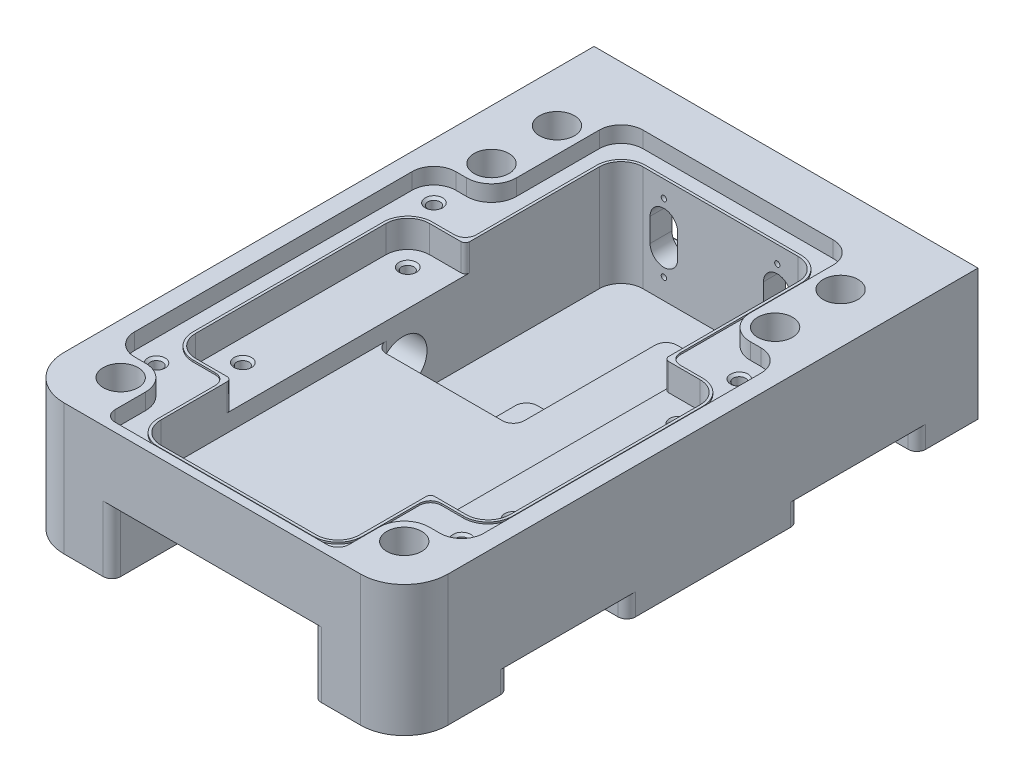
from build123d import *
from build123d.topology import SkipClean

# Parameters (mm, degrees)
SKETCH2_R                       = 2.54
BOSS_EXTRUDE1_DEPTH             = 9.525
CUT_EXTRUDE1_DEPTH              = 6.35
CUT_EXTRUDE7_DEPTH              = 2.3495
CUT_EXTRUDE8_DEPTH              = 12.7
F_0_80_TAPPED_HOLE2_D           = 1.19126
F_0_80_TAPPED_HOLE2_DEPTH       = 3.048
F_0_80_TAPPED_HOLE2_CSINK_D     = 1.905
F_0_80_TAPPED_HOLE2_CSINK_ANGLE = 90
F_0_80_TAPPED_HOLE2_TIP         = 0.357890611
BOSS_EXTRUDE2_START             = 4.0005
BOSS_EXTRUDE2_DEPTH             = 4.0005
F_0_80_TAPPED_HOLE1_D           = 1.19126
F_0_80_TAPPED_HOLE1_DEPTH       = 7.62
F_0_80_TAPPED_HOLE1_CSINK_D     = 1.905
F_0_80_TAPPED_HOLE1_CSINK_ANGLE = 90
F_0_80_TAPPED_HOLE1_TIP         = 0.357890611
BOSS_EXTRUDE9_START             = 0.254
BOSS_EXTRUDE9_DEPTH             = 0.254
LID_AND_GASKET_RECESS_DEPTH     = 2.3495
CUT_EXTRUDE19_DEPTH             = 15.113
BOSS_EXTRUDE7_START             = 11.43
BOSS_EXTRUDE7_DEPTH             = 11.43
F_2_56_TAPPED_HOLE1_AT_2_COUNT  = 2
F_2_56_TAPPED_HOLE1_AT_2_PITCH  = 24.003
CUT_EXTRUDE23_DEPTH             = 2.3495
CUT_EXTRUDE45_DEPTH             = 3.683
F_2_56_TAPPED_HOLE2_D           = 1.778
F_2_56_TAPPED_HOLE2_DEPTH       = 7.62
F_2_56_TAPPED_HOLE2_CSINK_D     = 2.54
F_2_56_TAPPED_HOLE2_CSINK_ANGLE = 100
F_2_56_TAPPED_HOLE2_TIP         = 0.53416509
BOSS_EXTRUDE14_START            = 8.89
BOSS_EXTRUDE14_DEPTH            = 8.89
CUT_EXTRUDE43_DEPTH             = 2.54
BOSS_EXTRUDE15_START            = 0.254
BOSS_EXTRUDE15_DEPTH            = 0.254
CUT_EXTRUDE54_DEPTH             = 9.525
CUT_EXTRUDE41_REACH             = 56.849
SKETCH133_R                     = 2.1082
CUT_EXTRUDE41_DIRECTION_2_DEPTH = 55.848857864
CUT_EXTRUDE47_DEPTH             = 76.067770602
CUT_EXTRUDE47_DEPTH_BACK        = 4.445
M8X0_75_TAPPED_HOLE1_D          = 7
M8X0_75_TAPPED_HOLE1_DEPTH      = 19.05
M8X0_75_TAPPED_HOLE1_TIP        = 2.103012167
CUT_EXTRUDE52_DEPTH             = 3.175
CUT_EXTRUDE53_DEPTH             = 2.54
FILLET4_R                       = 1.27
CUT_EXTRUDE55_START             = -4.445
CUT_EXTRUDE55_DEPTH             = 4.445
FILLET5_R                       = 1.27
CUT_EXTRUDE56_DEPTH             = 55.848857882
CUT_EXTRUDE56_DEPTH_BACK        = 18.0975
SKETCH155_R                     = 4.365625
CUT_EXTRUDE57_DEPTH             = 3.81


with BuildPart() as part:
    # Sketch2 → Boss-Extrude1 (new, symmetric)
    # profile 1 of 8: a face of its own
    with SkipClean():  # the faces are left unmerged after this step: merging them gives an invalid solid
        with BuildSketch(Plane(origin=(0, 0, 0), x_dir=(1, 0, 0), z_dir=(0, 1, 0))):
            with BuildLine():
                ThreePointArc((-27.94, 42.8625), (-26.080128061, 47.352628061), (-21.59, 49.2125))
                Line((-21.59, 49.2125), (-27.94, 49.2125))
                Line((-27.94, 49.2125), (-27.94, 42.8625))
            make_face()
        # profile 2 of 8: a face of its own
        with BuildSketch(Plane(origin=(0, 0, 0), x_dir=(1, 0, 0), z_dir=(0, 1, 0))):
            with BuildLine():
                Line((21.59, 49.2125), (-21.59, 49.2125))
                ThreePointArc((-21.59, 49.2125), (-26.080128061, 47.352628061), (-27.94, 42.8625))
                ThreePointArc((-27.94, 42.8625), (-27.690261841, 34.53040929), (-26.941944002, 26.22823336))
                ThreePointArc((-26.941944002, 26.22823336), (-21.017816046, 33.326100769), (-14.2875, 26.9875))
                ThreePointArc((-14.2875, 26.9875), (-16.971325791, 21.802746711), (-22.754166667, 21.000662586))
                ThreePointArc((-22.754166667, 21.000662586), (-21.220123356, 19.840330984), (-20.6375, 18.007243879))
                Line((-20.6375, 18.007243879), (-20.6375, -18.007243879))
                ThreePointArc((-20.6375, -18.007243879), (-21.220123356, -19.840330984), (-22.754166667, -21.000662586))
                ThreePointArc((-22.754166667, -21.000662586), (-16.971325791, -21.802746711), (-14.2875, -26.9875))
                ThreePointArc((-14.2875, -26.9875), (-16.147371939, -31.477628061), (-20.6375, -33.3375))
                Line((-20.6375, -33.3375), (20.6375, -33.3375))
                ThreePointArc((20.6375, -33.3375), (14.378949146, -25.913702435), (22.754166667, -21.000662586))
                ThreePointArc((22.754166667, -21.000662586), (21.220123356, -19.840330984), (20.6375, -18.007243879))
                Line((20.6375, -18.007243879), (20.6375, 18.007243879))
                ThreePointArc((20.6375, 18.007243879), (21.220123356, 19.840330984), (22.754166667, 21.000662586))
                ThreePointArc((22.754166667, 21.000662586), (15.452746711, 30.653674209), (26.9875, 26.9875))
                ThreePointArc((26.9875, 26.9875), (26.976100769, 26.607183954), (26.941944002, 26.22823336))
                ThreePointArc((26.941944002, 26.22823336), (27.690261841, 34.53040929), (27.94, 42.8625))
                ThreePointArc((27.94, 42.8625), (26.080128061, 47.352628061), (21.59, 49.2125))
            make_face()
            with Locations(Location((-20.6375, 36.5125, 0), (0, 0, 90))):
                Circle(SKETCH2_R, mode=Mode.SUBTRACT)
            with Locations(Location((20.6375, 36.5125, 0), (0, 0, 90))):
                Circle(SKETCH2_R, mode=Mode.SUBTRACT)
        # profile 3 of 8: a face of its own
        with BuildSketch(Plane(origin=(0, 0, 0), x_dir=(1, 0, 0), z_dir=(0, 1, 0))):
            with BuildLine():
                Line((27.94, 49.2125), (21.59, 49.2125))
                ThreePointArc((21.59, 49.2125), (26.080128061, 47.352628061), (27.94, 42.8625))
                Line((27.94, 42.8625), (27.94, 49.2125))
            make_face()
        # profile 4 of 8: a face of its own
        with BuildSketch(Plane(origin=(0, 0, 0), x_dir=(1, 0, 0), z_dir=(0, 1, 0))):
            with BuildLine():
                ThreePointArc((-26.941944002, 26.22823336), (-27.690261841, 34.53040929), (-27.94, 42.8625))
                Line((-27.94, 42.8625), (-27.94, -27.94))
                ThreePointArc((-27.94, -27.94), (-26.080128061, -32.430128061), (-21.59, -34.29))
                Line((-21.59, -34.29), (21.59, -34.29))
                ThreePointArc((21.59, -34.29), (26.080128061, -32.430128061), (27.94, -27.94))
                Line((27.94, -27.94), (27.94, 42.8625))
                ThreePointArc((27.94, 42.8625), (27.690261841, 34.53040929), (26.941944002, 26.22823336))
                ThreePointArc((26.941944002, 26.22823336), (25.593370284, 23.017380389), (22.754166667, 21.000662586))
                ThreePointArc((22.754166667, 21.000662586), (21.220123356, 19.840330984), (20.6375, 18.007243879))
                Line((20.6375, 18.007243879), (20.6375, -18.007243879))
                ThreePointArc((20.6375, -18.007243879), (21.220123356, -19.840330984), (22.754166667, -21.000662586))
                ThreePointArc((22.754166667, -21.000662586), (25.822253289, -23.321325791), (26.9875, -26.9875))
                ThreePointArc((26.9875, -26.9875), (25.127628061, -31.477628061), (20.6375, -33.3375))
                Line((20.6375, -33.3375), (-20.6375, -33.3375))
                ThreePointArc((-20.6375, -33.3375), (-26.896050854, -28.061297565), (-22.754166667, -21.000662586))
                ThreePointArc((-22.754166667, -21.000662586), (-21.220123356, -19.840330984), (-20.6375, -18.007243879))
                Line((-20.6375, -18.007243879), (-20.6375, 18.007243879))
                ThreePointArc((-20.6375, 18.007243879), (-21.220123356, 19.840330984), (-22.754166667, 21.000662586))
                ThreePointArc((-22.754166667, 21.000662586), (-25.593370284, 23.017380389), (-26.941944002, 26.22823336))
            make_face()
        # profile 5 of 8: a face of its own
        with BuildSketch(Plane(origin=(0, 0, 0), x_dir=(1, 0, 0), z_dir=(0, 1, 0))):
            with BuildLine():
                ThreePointArc((-14.2875, 26.9875), (-21.017816046, 33.326100769), (-26.941944002, 26.22823336))
                ThreePointArc((-26.941944002, 26.22823336), (-25.593370284, 23.017380389), (-22.754166667, 21.000662586))
                ThreePointArc((-22.754166667, 21.000662586), (-16.971325791, 21.802746711), (-14.2875, 26.9875))
            make_face()
            with Locations(Location((-20.6375, 26.9875, 0), (0, 0, 90))):
                Circle(SKETCH2_R, mode=Mode.SUBTRACT)
        # profile 6 of 8: a face of its own
        with BuildSketch(Plane(origin=(0, 0, 0), x_dir=(1, 0, 0), z_dir=(0, 1, 0))):
            with BuildLine():
                ThreePointArc((22.754166667, 21.000662586), (25.593370284, 23.017380389), (26.941944002, 26.22823336))
                ThreePointArc((26.941944002, 26.22823336), (26.976100769, 26.607183954), (26.9875, 26.9875))
                ThreePointArc((26.9875, 26.9875), (15.452746711, 30.653674209), (22.754166667, 21.000662586))
            make_face()
            with Locations(Location((20.6375, 26.9875, 0), (0, 0, 90))):
                Circle(SKETCH2_R, mode=Mode.SUBTRACT)
        # profile 7 of 8: a face of its own
        with BuildSketch(Plane(origin=(0, 0, 0), x_dir=(1, 0, 0), z_dir=(0, 1, 0))):
            with BuildLine():
                ThreePointArc((-14.2875, -26.9875), (-16.971325791, -21.802746711), (-22.754166667, -21.000662586))
                ThreePointArc((-22.754166667, -21.000662586), (-26.896050854, -28.061297565), (-20.6375, -33.3375))
                ThreePointArc((-20.6375, -33.3375), (-16.147371939, -31.477628061), (-14.2875, -26.9875))
            make_face()
            with Locations(Location((-20.6375, -26.9875, 0), (0, 0, 90))):
                Circle(SKETCH2_R, mode=Mode.SUBTRACT)
        # profile 8 of 8: a face of its own
        with BuildSketch(Plane(origin=(0, 0, 0), x_dir=(1, 0, 0), z_dir=(0, 1, 0))):
            with BuildLine():
                ThreePointArc((26.9875, -26.9875), (25.822253289, -23.321325791), (22.754166667, -21.000662586))
                ThreePointArc((22.754166667, -21.000662586), (14.378949146, -25.913702435), (20.6375, -33.3375))
                ThreePointArc((20.6375, -33.3375), (25.127628061, -31.477628061), (26.9875, -26.9875))
            make_face()
            with Locations(Location((20.6375, -26.9875, 0), (0, 0, 90))):
                Circle(SKETCH2_R, mode=Mode.SUBTRACT)
        extrude(amount=BOSS_EXTRUDE1_DEPTH, both=True)

    # Sketch4 → Cut-Extrude1 (cut)
    with BuildSketch(Plane(origin=(0, 0, -49.2125), x_dir=(-1, 0, 0), z_dir=(0, 0, -1))):
        with BuildLine():
            Line((-23.8125, -6.7945), (23.8125, -6.7945))
            ThreePointArc((23.8125, -6.7945), (24.935032015, -6.329532015), (25.4, -5.207))
            Line((25.4, -5.207), (25.4, 5.207))
            ThreePointArc((25.4, 5.207), (24.935032015, 6.329532015), (23.8125, 6.7945))
            Line((23.8125, 6.7945), (-23.8125, 6.7945))
            ThreePointArc((-23.8125, 6.7945), (-24.935032015, 6.329532015), (-25.4, 5.207))
            Line((-25.4, 5.207), (-25.4, -5.207))
            ThreePointArc((-25.4, -5.207), (-24.935032015, -6.329532015), (-23.8125, -6.7945))
        make_face()
    extrude(amount=-CUT_EXTRUDE1_DEPTH, mode=Mode.SUBTRACT)

    # Sketch11 → Cut-Extrude7 (cut)
    with BuildSketch(Plane(origin=(0, 0, -49.2125), x_dir=(-1, 0, 0), z_dir=(0, 0, -1))):
        with BuildLine():
            Line((-27.432, 5.207), (-27.432, -5.207))
            ThreePointArc((-27.432, -5.207), (-26.371872995, -7.766372995), (-23.8125, -8.8265))
            Line((-23.8125, -8.8265), (23.8125, -8.8265))
            ThreePointArc((23.8125, -8.8265), (26.371872995, -7.766372995), (27.432, -5.207))
            Line((27.432, -5.207), (27.432, 5.207))
            ThreePointArc((27.432, 5.207), (26.371872995, 7.766372995), (23.8125, 8.8265))
            Line((23.8125, 8.8265), (-23.8125, 8.8265))
            ThreePointArc((-23.8125, 8.8265), (-26.371872995, 7.766372995), (-27.432, 5.207))
        make_face()
    extrude(amount=-CUT_EXTRUDE7_DEPTH, mode=Mode.SUBTRACT)

    # Sketch13 → Cut-Extrude8 (cut)
    with BuildSketch(Plane(origin=(0, 0, -42.8625), x_dir=(-1, 0, 0), z_dir=(0, 0, -1))):
        with BuildLine():
            Line((6.25, -1.7145), (6.25, 1.7145))
            ThreePointArc((6.25, 1.7145), (8.255, 3.7195), (10.26, 1.7145))
            Line((10.26, 1.7145), (10.26, -1.7145))
            ThreePointArc((10.26, -1.7145), (8.255, -3.7195), (6.25, -1.7145))
        make_face()
        with BuildLine():
            Line((-6.25, -1.7145), (-6.25, 1.7145))
            ThreePointArc((-6.25, 1.7145), (-8.255, 3.7195), (-10.26, 1.7145))
            Line((-10.26, 1.7145), (-10.26, -1.7145))
            ThreePointArc((-10.26, -1.7145), (-8.255, -3.7195), (-6.25, -1.7145))
        make_face()
    extrude(amount=-CUT_EXTRUDE8_DEPTH, mode=Mode.SUBTRACT)

    # #0-80 Tapped Hole2
    with Locations(Plane(origin=(23.8125, 5.207, -42.8625), x_dir=(-1, 0, 0), z_dir=(0, 0, -1))):
        with Locations((0, 0), (0, -10.414), (15.5575, -10.16), (15.5575, -0.254), (32.0675, -0.254), (32.0675, -10.16), (47.625, -10.414), (47.625, 0)):
            CounterSinkHole(F_0_80_TAPPED_HOLE2_D / 2, F_0_80_TAPPED_HOLE2_CSINK_D / 2, depth=F_0_80_TAPPED_HOLE2_DEPTH, counter_sink_angle=F_0_80_TAPPED_HOLE2_CSINK_ANGLE)
            with Locations((0, 0, -(F_0_80_TAPPED_HOLE2_DEPTH + F_0_80_TAPPED_HOLE2_TIP / 2))):  # 118° drill point
                Cone(0, F_0_80_TAPPED_HOLE2_D / 2, F_0_80_TAPPED_HOLE2_TIP, mode=Mode.SUBTRACT)

    # Sketch16 → Boss-Extrude2 (add)
    with BuildSketch(Plane(origin=(0, 0, -42.8625), x_dir=(-1, 0, 0), z_dir=(0, 0, -1)).offset(BOSS_EXTRUDE2_START)):
        with BuildLine():
            Line((-23.014, 2.990522163), (-23.014, -2.990522163))
            ThreePointArc((-23.014, -2.990522163), (-23.216818656, -3.455757895), (-23.695714286, -3.623801545))
            ThreePointArc((-23.695714286, -3.623801545), (-24.892953361, -4.043910672), (-25.4, -5.207))
            Line((-25.4, -5.207), (-25.4, 5.207))
            ThreePointArc((-25.4, 5.207), (-24.892953361, 4.043910672), (-23.695714286, 3.623801545))
            ThreePointArc((-23.695714286, 3.623801545), (-23.216818656, 3.455757895), (-23.014, 2.990522163))
        make_face()
    boss_extrude2 = extrude(amount=-BOSS_EXTRUDE2_DEPTH)

    # Mirror1: Boss-Extrude2 across plane
    add(boss_extrude2.mirror(Plane(origin=(0, 0, 0), x_dir=(0, 0, 1), z_dir=(1, 0, 0))))

    # #0-80 Tapped Hole1
    with Locations(Plane(origin=(25.223, 0, -46.863), x_dir=(-1, 0, 0), z_dir=(0, 0, -1))):
        with Locations((0, 0), (50.446, 0)):
            CounterSinkHole(F_0_80_TAPPED_HOLE1_D / 2, F_0_80_TAPPED_HOLE1_CSINK_D / 2, depth=F_0_80_TAPPED_HOLE1_DEPTH, counter_sink_angle=F_0_80_TAPPED_HOLE1_CSINK_ANGLE)
            with Locations((0, 0, -(F_0_80_TAPPED_HOLE1_DEPTH + F_0_80_TAPPED_HOLE1_TIP / 2))):  # 118° drill point
                Cone(0, F_0_80_TAPPED_HOLE1_D / 2, F_0_80_TAPPED_HOLE1_TIP, mode=Mode.SUBTRACT)

    # Sketch104 → Boss-Extrude9 (add)
    with BuildSketch(Plane(origin=(0, 0, -46.863), x_dir=(-1, 0, 0), z_dir=(0, 0, -1)).offset(BOSS_EXTRUDE9_START)):
        with BuildLine():
            ThreePointArc((24.080632184, 3.256846831), (25.776407936, 5.341379569), (23.8125, 7.1755))
            Line((23.8125, 7.1755), (-23.8125, 7.1755))
            ThreePointArc((-23.8125, 7.1755), (-25.776407936, 5.341379569), (-24.080632184, 3.256846831))
            ThreePointArc((-24.080632184, 3.256846831), (-23.590478498, 2.992136648), (-23.395, 2.470494747))
            Line((-23.395, 2.470494747), (-23.395, -2.470494747))
            ThreePointArc((-23.395, -2.470494747), (-23.590478498, -2.992136648), (-24.080632184, -3.256846831))
            ThreePointArc((-24.080632184, -3.256846831), (-25.776407936, -5.341379569), (-23.8125, -7.1755))
            Line((-23.8125, -7.1755), (23.8125, -7.1755))
            ThreePointArc((23.8125, -7.1755), (25.776407936, -5.341379569), (24.080632184, -3.256846831))
            ThreePointArc((24.080632184, -3.256846831), (23.590478498, -2.992136648), (23.395, -2.470494747))
            Line((23.395, -2.470494747), (23.395, 2.470494747))
            ThreePointArc((23.395, 2.470494747), (23.590478498, 2.992136648), (24.080632184, 3.256846831))
        make_face()
        with BuildLine():
            Line((23.014, 2.990522163), (23.014, -2.990522163))
            ThreePointArc((23.014, -2.990522163), (23.216818656, -3.455757895), (23.695714286, -3.623801545))
            ThreePointArc((23.695714286, -3.623801545), (25.398924249, -5.148567547), (23.8125, -6.7945))
            Line((23.8125, -6.7945), (-23.8125, -6.7945))
            ThreePointArc((-23.8125, -6.7945), (-25.398924249, -5.148567547), (-23.695714286, -3.623801545))
            ThreePointArc((-23.695714286, -3.623801545), (-23.216818656, -3.455757895), (-23.014, -2.990522163))
            Line((-23.014, -2.990522163), (-23.014, 2.990522163))
            ThreePointArc((-23.014, 2.990522163), (-23.216818656, 3.455757895), (-23.695714286, 3.623801545))
            ThreePointArc((-23.695714286, 3.623801545), (-25.398924249, 5.148567547), (-23.8125, 6.7945))
            Line((-23.8125, 6.7945), (23.8125, 6.7945))
            ThreePointArc((23.8125, 6.7945), (25.398924249, 5.148567547), (23.695714286, 3.623801545))
            ThreePointArc((23.695714286, 3.623801545), (23.216818656, 3.455757895), (23.014, 2.990522163))
        make_face(mode=Mode.SUBTRACT)
    extrude(amount=-BOSS_EXTRUDE9_DEPTH)

    # Sketch27 → Lid and Gasket Recess (cut)
    with BuildSketch(Plane(origin=(0, 9.525, 0), x_dir=(1, 0, 0), z_dir=(0, 1, 0))):
        with BuildLine():
            Line((22.225, 23.368), (20.6375, 23.368))
            ThreePointArc((20.6375, 23.368), (18.078127005, 24.428127005), (17.018, 26.9875))
            Line((17.018, 26.9875), (17.018, 39.0525))
            ThreePointArc((17.018, 39.0525), (16.08806403, 41.29756403), (13.843, 42.2275))
            Line((13.843, 42.2275), (0, 42.2275))
            Line((0, 42.2275), (0, -23.368))
            Line((0, -23.368), (22.225, -23.368))
            ThreePointArc((22.225, -23.368), (24.47006403, -22.43806403), (25.4, -20.193))
            Line((25.4, -20.193), (25.4, 20.193))
            ThreePointArc((25.4, 20.193), (24.47006403, 22.43806403), (22.225, 23.368))
        make_face()
        with BuildLine():
            Line((0, -23.368), (0, 42.2275))
            Line((0, 42.2275), (-13.843, 42.2275))
            ThreePointArc((-13.843, 42.2275), (-16.08806403, 41.29756403), (-17.018, 39.0525))
            Line((-17.018, 39.0525), (-17.018, 26.9875))
            Line((-17.018, 26.9875), (-17.018, 7.9375))
            ThreePointArc((-17.018, 7.9375), (-18.078127005, 5.378127005), (-20.6375, 4.318))
            Line((-20.6375, 4.318), (-22.225, 4.318))
            ThreePointArc((-22.225, 4.318), (-24.47006403, 3.38806403), (-25.4, 1.143))
            Line((-25.4, 1.143), (-25.4, -20.193))
            ThreePointArc((-25.4, -20.193), (-24.47006403, -22.43806403), (-22.225, -23.368))
            Line((-22.225, -23.368), (0, -23.368))
        make_face()
        with BuildLine():
            Line((-17.018, 7.9375), (-17.018, 26.9875))
            ThreePointArc((-17.018, 26.9875), (-18.078127005, 24.428127005), (-20.6375, 23.368))
            Line((-20.6375, 23.368), (-22.225, 23.368))
            ThreePointArc((-22.225, 23.368), (-24.47006403, 22.43806403), (-25.4, 20.193))
            Line((-25.4, 20.193), (-25.4, 1.143))
            ThreePointArc((-25.4, 1.143), (-24.47006403, 3.38806403), (-22.225, 4.318))
            Line((-22.225, 4.318), (-20.6375, 4.318))
            ThreePointArc((-20.6375, 4.318), (-18.078127005, 5.378127005), (-17.018, 7.9375))
        make_face()
    extrude(amount=-LID_AND_GASKET_RECESS_DEPTH, mode=Mode.SUBTRACT)

    # Sketch28 → Cut-Extrude19 (cut)
    with BuildSketch(Plane(origin=(0, 7.1755, 0), x_dir=(1, 0, 0), z_dir=(0, 1, 0))):
        with BuildLine():
            Line((19.685, 17.018), (15.113, 17.018))
            ThreePointArc((15.113, 17.018), (14.663987194, 17.203987194), (14.478, 17.653))
            Line((14.478, 17.653), (14.478, 36.5125))
            ThreePointArc((14.478, 36.5125), (13.54806403, 38.75756403), (11.303, 39.6875))
            Line((11.303, 39.6875), (-11.303, 39.6875))
            ThreePointArc((-11.303, 39.6875), (-13.54806403, 38.75756403), (-14.478, 36.5125))
            Line((-14.478, 36.5125), (-14.478, 17.653))
            ThreePointArc((-14.478, 17.653), (-14.663987194, 17.203987194), (-15.113, 17.018))
            Line((-15.113, 17.018), (-19.685, 17.018))
            ThreePointArc((-19.685, 17.018), (-21.93006403, 16.08806403), (-22.86, 13.843))
            Line((-22.86, 13.843), (-22.86, -13.843))
            ThreePointArc((-22.86, -13.843), (-21.93006403, -16.08806403), (-19.685, -17.018))
            Line((-19.685, -17.018), (19.685, -17.018))
            ThreePointArc((19.685, -17.018), (21.93006403, -16.08806403), (22.86, -13.843))
            Line((22.86, -13.843), (22.86, 13.843))
            ThreePointArc((22.86, 13.843), (21.93006403, 16.08806403), (19.685, 17.018))
        make_face()
    extrude(amount=-CUT_EXTRUDE19_DEPTH, mode=Mode.SUBTRACT)

    # Sketch31 → Boss-Extrude7 (add)
    with BuildSketch(Plane(origin=(0, -7.9375, 0), x_dir=(1, 0, 0), z_dir=(0, 1, 0)).offset(BOSS_EXTRUDE7_START)):
        with BuildLine():
            Line((-15.113, 17.018), (-19.685, 17.018))
            ThreePointArc((-19.685, 17.018), (-21.93006403, 16.08806403), (-22.86, 13.843))
            Line((-22.86, 13.843), (-22.86, -13.843))
            ThreePointArc((-22.86, -13.843), (-21.93006403, -16.08806403), (-19.685, -17.018))
            Line((-19.685, -17.018), (-11.303, -17.018))
            ThreePointArc((-11.303, -17.018), (-13.54806403, -16.08806403), (-14.478, -13.843))
            Line((-14.478, -13.843), (-14.478, 17.653))
            ThreePointArc((-14.478, 17.653), (-14.663987194, 17.203987194), (-15.113, 17.018))
        make_face()
        with BuildLine():
            ThreePointArc((14.478, -13.843), (13.54806403, -16.08806403), (11.303, -17.018))
            Line((11.303, -17.018), (19.685, -17.018))
            ThreePointArc((19.685, -17.018), (21.93006403, -16.08806403), (22.86, -13.843))
            Line((22.86, -13.843), (22.86, 13.843))
            ThreePointArc((22.86, 13.843), (21.93006403, 16.08806403), (19.685, 17.018))
            Line((19.685, 17.018), (15.113, 17.018))
            ThreePointArc((15.113, 17.018), (14.663987194, 17.203987194), (14.478, 17.653))
            Line((14.478, 17.653), (14.478, -13.843))
        make_face()
    extrude(amount=-BOSS_EXTRUDE7_DEPTH)

    # Sketch43 → #2-56 Tapped Hole1 (revolve, cut)
    with BuildSketch(Plane(origin=(19.685, 3.4925, 10.16), x_dir=(0, 0, 1), z_dir=(1, 0, 0))):
        Polygon((0, 0), (0, 6.12216509), (0.889, 5.588), (0.889, 0.381), (1.27, 0), align=None)
    f_2_56_tapped_hole1 = revolve(axis=Axis((19.685, 9.8425, 10.16), (0, -1, 0)), mode=Mode.SUBTRACT)

    # #2-56 Tapped Hole1 at 2: #2-56 Tapped Hole1 ×2
    with Locations(*[(0, 0, -i * F_2_56_TAPPED_HOLE1_AT_2_PITCH) for i in range(1, F_2_56_TAPPED_HOLE1_AT_2_COUNT)]):
        add(f_2_56_tapped_hole1, mode=Mode.SUBTRACT)

    # Mirror4: #2-56 Tapped Hole1 across plane
    add(f_2_56_tapped_hole1.mirror(Plane(origin=(0, 0, 0), x_dir=(0, 0, 1), z_dir=(1, 0, 0))), mode=Mode.SUBTRACT)

    # Mirror4 copy 1 sketch → Mirror4 copy 1 (revolve, cut)
    with BuildSketch(Plane(origin=(-19.685, 3.4925, -13.843), x_dir=(0, 0, 1), z_dir=(-1, 0, 0))):
        Polygon((0, 0), (0, -6.12216509), (0.889, -5.588), (0.889, -0.381), (1.27, 0), align=None)
    revolve(axis=Axis((-19.685, 9.8425, -13.843), (0, 1, 0)), mode=Mode.SUBTRACT)

    # Sketch35 → Cut-Extrude23 (cut)
    with BuildSketch(Plane(origin=(0, 9.525, 0), x_dir=(1, 0, 0), z_dir=(0, 1, 0))):
        with BuildLine():
            Line((17.018, -31.4325), (17.018, -26.9875))
            ThreePointArc((17.018, -26.9875), (18.078127005, -24.428127005), (20.6375, -23.368))
            Line((20.6375, -23.368), (-20.6375, -23.368))
            ThreePointArc((-20.6375, -23.368), (-18.078127005, -24.428127005), (-17.018, -26.9875))
            Line((-17.018, -26.9875), (-17.018, -31.4325))
            ThreePointArc((-17.018, -31.4325), (-16.553032015, -32.555032015), (-15.4305, -33.02))
            Line((-15.4305, -33.02), (15.4305, -33.02))
            ThreePointArc((15.4305, -33.02), (16.553032015, -32.555032015), (17.018, -31.4325))
        make_face()
    extrude(amount=-CUT_EXTRUDE23_DEPTH, mode=Mode.SUBTRACT)

    # Sketch57 → Cut-Extrude45 (cut)
    with BuildSketch(Plane(origin=(0, 7.1755, 0), x_dir=(1, 0, 0), z_dir=(0, 1, 0))):
        with BuildLine():
            Line((-15.113, -17.018), (15.113, -17.018))
            ThreePointArc((15.113, -17.018), (14.663987194, -17.203987194), (14.478, -17.653))
            Line((14.478, -17.653), (14.478, -27.305))
            ThreePointArc((14.478, -27.305), (13.54806403, -29.55006403), (11.303, -30.48))
            Line((11.303, -30.48), (-11.303, -30.48))
            ThreePointArc((-11.303, -30.48), (-13.54806403, -29.55006403), (-14.478, -27.305))
            Line((-14.478, -27.305), (-14.478, -17.653))
            ThreePointArc((-14.478, -17.653), (-14.663987194, -17.203987194), (-15.113, -17.018))
        make_face()
    extrude(amount=-CUT_EXTRUDE45_DEPTH, mode=Mode.SUBTRACT)

    # #2-56 Tapped Hole2
    with Locations(Plane(origin=(-22.225, 7.1755, -20.193), x_dir=(0, 0, 1), z_dir=(0, 1, 0))):
        with Locations((0, 0), (40.386, 44.45), (0, 44.45), (40.386, 0)):
            CounterSinkHole(F_2_56_TAPPED_HOLE2_D / 2, F_2_56_TAPPED_HOLE2_CSINK_D / 2, depth=F_2_56_TAPPED_HOLE2_DEPTH, counter_sink_angle=F_2_56_TAPPED_HOLE2_CSINK_ANGLE)
            with Locations((0, 0, -(F_2_56_TAPPED_HOLE2_DEPTH + F_2_56_TAPPED_HOLE2_TIP / 2))):  # 118° drill point
                Cone(0, F_2_56_TAPPED_HOLE2_D / 2, F_2_56_TAPPED_HOLE2_TIP, mode=Mode.SUBTRACT)

    # Sketch129 → Boss-Extrude14 (add)
    with BuildSketch(Plane(origin=(0, -7.9375, 0), x_dir=(1, 0, 0), z_dir=(0, 1, 0)).offset(BOSS_EXTRUDE14_START)):
        with BuildLine():
            Line((4.0005, 12.192), (0.8255, 12.192))
            ThreePointArc((0.8255, 12.192), (-0.297032015, 11.727032015), (-0.762, 10.6045))
            Line((-0.762, 10.6045), (-0.762, 5.5245))
            ThreePointArc((-0.762, 5.5245), (-1.226967985, 4.401967985), (-2.3495, 3.937))
            Line((-2.3495, 3.937), (-12.8905, 3.937))
            ThreePointArc((-12.8905, 3.937), (-14.013032015, 4.401967985), (-14.478, 5.5245))
            Line((-14.478, 5.5245), (-14.478, -13.843))
            ThreePointArc((-14.478, -13.843), (-13.54806403, -16.08806403), (-11.303, -17.018))
            Line((-11.303, -17.018), (11.303, -17.018))
            ThreePointArc((11.303, -17.018), (13.54806403, -16.08806403), (14.478, -13.843))
            Line((14.478, -13.843), (14.478, 13.7795))
            Line((14.478, 13.7795), (14.478, 27.7495))
            ThreePointArc((14.478, 27.7495), (14.013032015, 26.626967985), (12.8905, 26.162))
            Line((12.8905, 26.162), (7.1755, 26.162))
            ThreePointArc((7.1755, 26.162), (6.052967985, 25.697032015), (5.588, 24.5745))
            Line((5.588, 24.5745), (5.588, 13.7795))
            ThreePointArc((5.588, 13.7795), (5.123032015, 12.656967985), (4.0005, 12.192))
        make_face()
    extrude(amount=-BOSS_EXTRUDE14_DEPTH)

    # Sketch135 → Cut-Extrude43 (cut)
    with BuildSketch(Plane(origin=(0, 3.4925, 0), x_dir=(1, 0, 0), z_dir=(0, 1, 0))):
        with BuildLine():
            ThreePointArc((-11.303, -17.018), (-13.54806403, -16.08806403), (-14.478, -13.843))
            Line((-14.478, -13.843), (-14.478, -17.653))
            Line((-14.478, -17.653), (-14.478, -27.305))
            ThreePointArc((-14.478, -27.305), (-13.54806403, -29.55006403), (-11.303, -30.48))
            Line((-11.303, -30.48), (11.303, -30.48))
            ThreePointArc((11.303, -30.48), (13.54806403, -29.55006403), (14.478, -27.305))
            Line((14.478, -27.305), (14.478, -17.653))
            Line((14.478, -17.653), (14.478, -13.843))
            ThreePointArc((14.478, -13.843), (13.54806403, -16.08806403), (11.303, -17.018))
            Line((11.303, -17.018), (-11.303, -17.018))
        make_face()
    extrude(amount=-CUT_EXTRUDE43_DEPTH, mode=Mode.SUBTRACT)

    # Sketch153 → Boss-Extrude15 (add)
    with BuildSketch(Plane(origin=(0, 7.1755, 0), x_dir=(1, 0, 0), z_dir=(0, 1, 0)).offset(BOSS_EXTRUDE15_START)):
        with BuildLine():
            ThreePointArc((-23.241, -13.843), (-22.199471714, -16.357471714), (-19.685, -17.399))
            Line((-19.685, -17.399), (-16.4465, -17.399))
            ThreePointArc((-16.4465, -17.399), (-15.323967985, -17.863967985), (-14.859, -18.9865))
            Line((-14.859, -18.9865), (-14.859, -27.305))
            ThreePointArc((-14.859, -27.305), (-13.817471714, -29.819471714), (-11.303, -30.861))
            Line((-11.303, -30.861), (11.303, -30.861))
            ThreePointArc((11.303, -30.861), (13.817471714, -29.819471714), (14.859, -27.305))
            Line((14.859, -27.305), (14.859, -18.9865))
            ThreePointArc((14.859, -18.9865), (15.323967985, -17.863967985), (16.4465, -17.399))
            Line((16.4465, -17.399), (19.685, -17.399))
            ThreePointArc((19.685, -17.399), (22.199471714, -16.357471714), (23.241, -13.843))
            Line((23.241, -13.843), (23.241, 13.843))
            ThreePointArc((23.241, 13.843), (22.199471714, 16.357471714), (19.685, 17.399))
            Line((19.685, 17.399), (16.4465, 17.399))
            ThreePointArc((16.4465, 17.399), (15.323967985, 17.863967985), (14.859, 18.9865))
            Line((14.859, 18.9865), (14.859, 36.5125))
            ThreePointArc((14.859, 36.5125), (13.817471714, 39.026971714), (11.303, 40.0685))
            Line((11.303, 40.0685), (-11.303, 40.0685))
            ThreePointArc((-11.303, 40.0685), (-13.817471714, 39.026971714), (-14.859, 36.5125))
            Line((-14.859, 36.5125), (-14.859, 18.9865))
            ThreePointArc((-14.859, 18.9865), (-15.323967985, 17.863967985), (-16.4465, 17.399))
            Line((-16.4465, 17.399), (-19.685, 17.399))
            ThreePointArc((-19.685, 17.399), (-22.199471714, 16.357471714), (-23.241, 13.843))
            Line((-23.241, 13.843), (-23.241, -13.843))
        make_face()
        with BuildLine():
            Line((-15.113, -17.018), (-19.685, -17.018))
            ThreePointArc((-19.685, -17.018), (-21.93006403, -16.08806403), (-22.86, -13.843))
            Line((-22.86, -13.843), (-22.86, 13.843))
            ThreePointArc((-22.86, 13.843), (-21.93006403, 16.08806403), (-19.685, 17.018))
            Line((-19.685, 17.018), (-15.113, 17.018))
            ThreePointArc((-15.113, 17.018), (-14.663987194, 17.203987194), (-14.478, 17.653))
            Line((-14.478, 17.653), (-14.478, 36.5125))
            ThreePointArc((-14.478, 36.5125), (-13.54806403, 38.75756403), (-11.303, 39.6875))
            Line((-11.303, 39.6875), (11.303, 39.6875))
            ThreePointArc((11.303, 39.6875), (13.54806403, 38.75756403), (14.478, 36.5125))
            Line((14.478, 36.5125), (14.478, 17.653))
            ThreePointArc((14.478, 17.653), (14.663987194, 17.203987194), (15.113, 17.018))
            Line((15.113, 17.018), (19.685, 17.018))
            ThreePointArc((19.685, 17.018), (21.93006403, 16.08806403), (22.86, 13.843))
            Line((22.86, 13.843), (22.86, -13.843))
            ThreePointArc((22.86, -13.843), (21.93006403, -16.08806403), (19.685, -17.018))
            Line((19.685, -17.018), (15.113, -17.018))
            ThreePointArc((15.113, -17.018), (14.663987194, -17.203987194), (14.478, -17.653))
            Line((14.478, -17.653), (14.478, -27.305))
            ThreePointArc((14.478, -27.305), (13.54806403, -29.55006403), (11.303, -30.48))
            Line((11.303, -30.48), (-11.303, -30.48))
            ThreePointArc((-11.303, -30.48), (-13.54806403, -29.55006403), (-14.478, -27.305))
            Line((-14.478, -27.305), (-14.478, -17.653))
            ThreePointArc((-14.478, -17.653), (-14.663987194, -17.203987194), (-15.113, -17.018))
        make_face(mode=Mode.SUBTRACT)
    extrude(amount=-BOSS_EXTRUDE15_DEPTH)

    # Sketch151 → Cut-Extrude54 (cut)
    with BuildSketch(Plane.XZ.offset(9.525)):
        with BuildLine():
            Line((14.605, 34.29), (14.605, 0.1905))
            ThreePointArc((14.605, 0.1905), (13.67506403, -2.05456403), (11.43, -2.9845))
            Line((11.43, -2.9845), (-11.43, -2.9845))
            ThreePointArc((-11.43, -2.9845), (-13.67506403, -2.05456403), (-14.605, 0.1905))
            Line((-14.605, 0.1905), (-14.605, 34.29))
            Line((-14.605, 34.29), (14.605, 34.29))
        make_face()
    extrude(amount=-CUT_EXTRUDE54_DEPTH, mode=Mode.SUBTRACT)

    # Cut-Extrude41: up to this face of the body (flat: up to its plane)
    cut_extrude41_end = Plane(part.part.faces().sort_by_distance((10.033, -3.4925, -26.162))[0])
    # Sketch133 → Cut-Extrude41 (cut, up to the picked face)
    with BuildSketch(Plane.XY.offset(-2.9845), mode=Mode.PRIVATE) as cut_extrude41_sk1:
        with Locations(Location((2.413, -5.8293, 0), (0, 0, 318.851968798))):
            Circle(SKETCH133_R)
    cut_extrude41_tool1 = split(extrude(cut_extrude41_sk1.sketch, amount=-CUT_EXTRUDE41_REACH, mode=Mode.PRIVATE), bisect_by=cut_extrude41_end, keep=Keep.BOTH, mode=Mode.PRIVATE)
    # Sketch133 → Cut-Extrude41 (cut, up to the picked face)
    with BuildSketch(Plane.XY.offset(-2.9845), mode=Mode.PRIVATE) as cut_extrude41_sk2:
        with Locations((10.033, -4.7625)):
            Circle(SKETCH133_R)
    cut_extrude41_tool2 = split(extrude(cut_extrude41_sk2.sketch, amount=-CUT_EXTRUDE41_REACH, mode=Mode.PRIVATE), bisect_by=cut_extrude41_end, keep=Keep.BOTH, mode=Mode.PRIVATE)
    add(cut_extrude41_tool1.solids().sort_by(Axis((2.413, -5.8293, -2.9845), (0, 0, -1)))[0], mode=Mode.SUBTRACT)
    add(cut_extrude41_tool2.solids().sort_by(Axis((10.033, -4.7625, -2.9845), (0, 0, -1)))[0], mode=Mode.SUBTRACT)

    # Sketch133 → Cut-Extrude41 direction 2 (cut)
    with BuildSketch(Plane.XY.offset(-2.9845)):
        with Locations(Location((2.413, -5.8293, 0), (0, 0, 318.851968798))):
            Circle(SKETCH133_R)
        with Locations((10.033, -4.7625)):
            Circle(SKETCH133_R)
    extrude(amount=CUT_EXTRUDE41_DIRECTION_2_DEPTH, mode=Mode.SUBTRACT)

    # Sketch141 → Cut-Extrude47 (cut, two sides: drawn at the far end of the back side and taken through both)
    with BuildSketch(Plane.ZY.offset(27.94).offset(-CUT_EXTRUDE47_DEPTH_BACK)):
        with BuildLine():
            Line((-17.4625, -9.525), (1.5875, -9.525))
            ThreePointArc((1.5875, -9.525), (-0.65756403, -8.59506403), (-1.5875, -6.35))
            Line((-1.5875, -6.35), (-1.5875, -3.175))
            ThreePointArc((-1.5875, -3.175), (-7.9375, 3.175), (-14.2875, -3.175))
            Line((-14.2875, -3.175), (-14.2875, -6.35))
            ThreePointArc((-14.2875, -6.35), (-15.21743597, -8.59506403), (-17.4625, -9.525))
        make_face()
    extrude(amount=CUT_EXTRUDE47_DEPTH + CUT_EXTRUDE47_DEPTH_BACK, mode=Mode.SUBTRACT)

    # M8x0.75 tapped Hole1
    with Locations(Plane.ZY.offset(23.495)):
        with Locations((-7.9375, -3.175)):
            Hole(M8X0_75_TAPPED_HOLE1_D / 2, depth=M8X0_75_TAPPED_HOLE1_DEPTH)
            with Locations((0, 0, -(M8X0_75_TAPPED_HOLE1_DEPTH + M8X0_75_TAPPED_HOLE1_TIP / 2))):  # 118° drill point
                Cone(0, M8X0_75_TAPPED_HOLE1_D / 2, M8X0_75_TAPPED_HOLE1_TIP, mode=Mode.SUBTRACT)

    # Sketch149 → Cut-Extrude52 (cut)
    with BuildSketch(Plane.XZ.offset(9.525)):
        with BuildLine():
            Line((20.6375, 19.05), (28.04, 19.05))
            Line((28.04, 19.05), (28.04, 1.905))
            Line((28.04, 1.905), (20.6375, 1.905))
            ThreePointArc((20.6375, 1.905), (17.943423164, 3.020923164), (16.8275, 5.715))
            Line((16.8275, 5.715), (16.8275, 15.24))
            ThreePointArc((16.8275, 15.24), (17.943423164, 17.934076836), (20.6375, 19.05))
        make_face()
        with BuildLine():
            Line((-28.04, 19.05), (-28.04, 1.905))
            Line((-28.04, 1.905), (-20.6375, 1.905))
            ThreePointArc((-20.6375, 1.905), (-17.943423164, 3.020923164), (-16.8275, 5.715))
            Line((-16.8275, 5.715), (-16.8275, 15.24))
            ThreePointArc((-16.8275, 15.24), (-17.943423164, 17.934076836), (-20.6375, 19.05))
            Line((-20.6375, 19.05), (-28.04, 19.05))
        make_face()
        with BuildLine():
            Line((-20.6375, -40.3225), (-28.04, -40.3225))
            Line((-28.04, -40.3225), (-28.04, -23.1775))
            Line((-28.04, -23.1775), (-20.6375, -23.1775))
            ThreePointArc((-20.6375, -23.1775), (-17.943423164, -24.293423164), (-16.8275, -26.9875))
            Line((-16.8275, -26.9875), (-16.8275, -36.5125))
            ThreePointArc((-16.8275, -36.5125), (-17.943423164, -39.206576836), (-20.6375, -40.3225))
        make_face()
        with BuildLine():
            Line((28.04, -40.3225), (28.04, -23.1775))
            Line((28.04, -23.1775), (20.6375, -23.1775))
            ThreePointArc((20.6375, -23.1775), (17.943423164, -24.293423164), (16.8275, -26.9875))
            Line((16.8275, -26.9875), (16.8275, -36.5125))
            ThreePointArc((16.8275, -36.5125), (17.943423164, -39.206576836), (20.6375, -40.3225))
            Line((20.6375, -40.3225), (28.04, -40.3225))
        make_face()
    extrude(amount=-CUT_EXTRUDE52_DEPTH, mode=Mode.SUBTRACT)

    # Sketch150 → Cut-Extrude53 (cut)
    with BuildSketch(Plane.XZ.offset(6.35)):
        with BuildLine():
            Line((24.4475, 15.24), (24.4475, 5.715))
            ThreePointArc((24.4475, 5.715), (20.6375, 1.905), (16.8275, 5.715))
            Line((16.8275, 5.715), (16.8275, 15.24))
            ThreePointArc((16.8275, 15.24), (20.6375, 19.05), (24.4475, 15.24))
        make_face()
        with BuildLine():
            Line((-24.4475, 15.24), (-24.4475, 5.715))
            ThreePointArc((-24.4475, 5.715), (-20.6375, 1.905), (-16.8275, 5.715))
            Line((-16.8275, 5.715), (-16.8275, 15.24))
            ThreePointArc((-16.8275, 15.24), (-20.6375, 19.05), (-24.4475, 15.24))
        make_face()
        with BuildLine():
            Line((24.4475, -36.5125), (24.4475, -26.9875))
            ThreePointArc((24.4475, -26.9875), (20.6375, -23.1775), (16.8275, -26.9875))
            Line((16.8275, -26.9875), (16.8275, -36.5125))
            ThreePointArc((16.8275, -36.5125), (20.6375, -40.3225), (24.4475, -36.5125))
        make_face()
        with BuildLine():
            Line((-24.4475, -36.5125), (-24.4475, -26.9875))
            ThreePointArc((-24.4475, -26.9875), (-20.6375, -23.1775), (-16.8275, -26.9875))
            Line((-16.8275, -26.9875), (-16.8275, -36.5125))
            ThreePointArc((-16.8275, -36.5125), (-20.6375, -40.3225), (-24.4475, -36.5125))
        make_face()
    extrude(amount=-CUT_EXTRUDE53_DEPTH, mode=Mode.SUBTRACT)

    # Fillet4
    fillet4_edges = [part.edges().sort_by_distance(p)[0] for p in [
        (27.94, -7.9375, -40.3225),
        (27.94, -7.9375, -23.1775),
        (-27.94, -7.9375, -23.1775),
        (-27.94, -7.9375, -40.3225),
        (-27.94, -7.9375, 19.05),
        (-27.94, -7.9375, 1.905),
        (27.94, -7.9375, 1.905),
        (27.94, -7.9375, 19.05),
    ]]
    fillet(fillet4_edges, radius=FILLET4_R)

    # Sketch152 → Cut-Extrude55 (cut)
    with BuildSketch(Plane.ZY.offset(27.94).offset(CUT_EXTRUDE55_START)):
        with BuildLine():
            ThreePointArc((0.635, -9.378756964), (1.105669305, -9.488226279), (1.5875, -9.525))
            Line((1.5875, -9.525), (1.905, -9.525))
            Line((1.905, -9.525), (1.905, -6.35))
            Line((1.905, -6.35), (0.635, -6.35))
            ThreePointArc((0.635, -6.35), (-0.936544821, -5.699044821), (-1.5875, -4.1275))
            Line((-1.5875, -4.1275), (-1.5875, -6.35))
            ThreePointArc((-1.5875, -6.35), (-0.972266835, -8.228355331), (0.635, -9.378756964))
        make_face()
    extrude(amount=CUT_EXTRUDE55_DEPTH, mode=Mode.SUBTRACT)

    # Fillet5
    fillet5_edges = [part.edges().sort_by_distance(p)[0] for p in [
        (-23.495, -7.9375, 1.905),
        (14.605, -4.7625, 34.29),
        (-14.605, -4.7625, 34.29),
    ]]
    fillet(fillet5_edges, radius=FILLET5_R)

    # Sketch155 → Cut-Extrude56 (cut, two sides: drawn at the far end of the back side and taken through both)
    with BuildSketch(Plane.XY.offset(-2.9845).offset(-CUT_EXTRUDE56_DEPTH_BACK)):
        with Locations((10.033, -4.7625)):
            Circle(SKETCH155_R)
    extrude(amount=CUT_EXTRUDE56_DEPTH + CUT_EXTRUDE56_DEPTH_BACK, mode=Mode.SUBTRACT)

    # Sketch156 → Cut-Extrude57 (cut)
    with BuildSketch(Plane(origin=(0, 0.9525, 0), x_dir=(1, 0, 0), z_dir=(0, 1, 0))):
        with BuildLine():
            ThreePointArc((5.588, 5.5245), (5.123032015, 4.401967985), (4.0005, 3.937))
            Line((4.0005, 3.937), (-2.3495, 3.937))
            ThreePointArc((-2.3495, 3.937), (-1.226967985, 4.401967985), (-0.762, 5.5245))
            Line((-0.762, 5.5245), (-0.762, 10.6045))
            ThreePointArc((-0.762, 10.6045), (-0.297032015, 11.727032015), (0.8255, 12.192))
            Line((0.8255, 12.192), (4.0005, 12.192))
            ThreePointArc((4.0005, 12.192), (5.123032015, 12.656967985), (5.588, 13.7795))
            Line((5.588, 13.7795), (5.588, 5.5245))
        make_face()
    extrude(amount=-CUT_EXTRUDE57_DEPTH, mode=Mode.SUBTRACT)


solid = part.part
